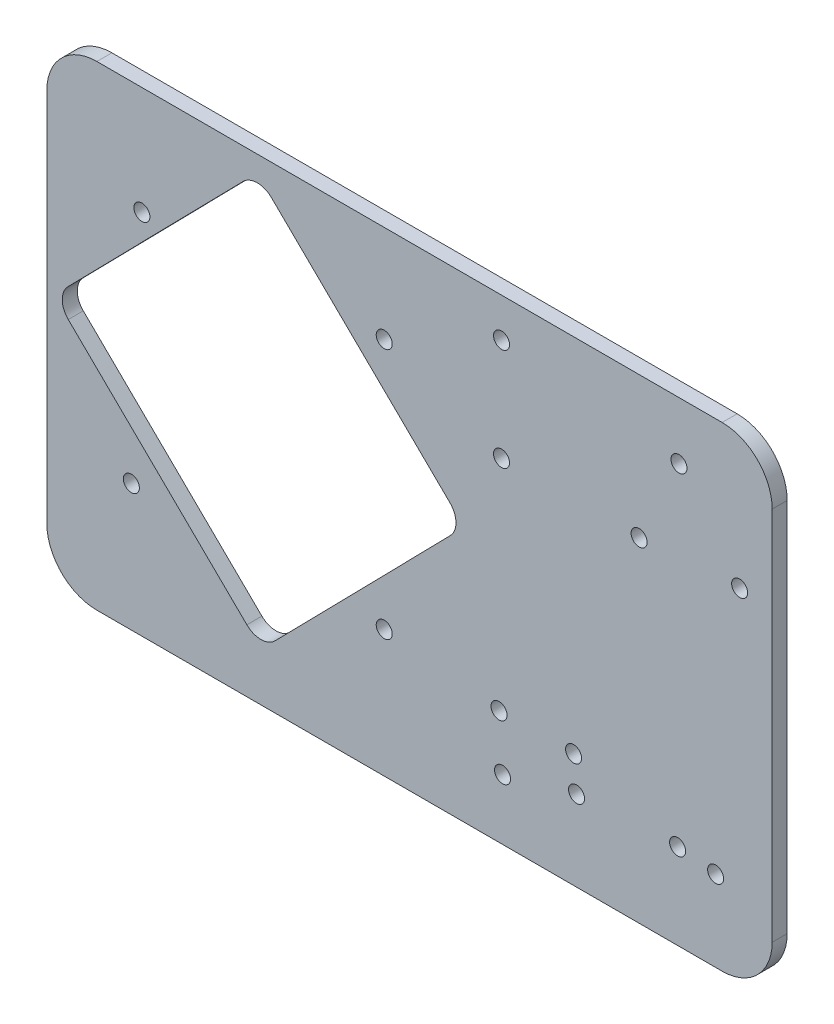
from build123d import *

# Parameters (mm, degrees)
ESQUISSE1_R               = 1.6
T_LE_DE_BASE_PLI_E1_DEPTH = 3


# Sheet-metal steps are written as plain solids
with BuildPart() as part:
    # Esquisse1 → Tôle de base pliée1 (new body)
    with BuildSketch(Plane.XY):
        with BuildLine():
            Line((10, 0), (135, 0))
            ThreePointArc((135, 0), (142.071067812, 2.928932188), (145, 10))
            Line((145, 10), (145, 85))
            ThreePointArc((145, 85), (142.071067812, 92.071067812), (135, 95))
            Line((135, 95), (10, 95))
            ThreePointArc((10, 95), (2.928932188, 92.071067812), (0, 85))
            Line((0, 85), (0, 10))
            ThreePointArc((0, 10), (2.928932188, 2.928932188), (10, 0))
        make_face()
        with Locations((90.9, 87.2)):
            Circle(ESQUISSE1_R, mode=Mode.SUBTRACT)
        with Locations((126.368886423, 83.535840528)):
            Circle(ESQUISSE1_R, mode=Mode.SUBTRACT)
        with Locations((138.5, 68.05)):
            Circle(ESQUISSE1_R, mode=Mode.SUBTRACT)
        with Locations((118.4, 66.74856953)):
            Circle(ESQUISSE1_R, mode=Mode.SUBTRACT)
        with Locations((90.9, 66.74856953)):
            Circle(ESQUISSE1_R, mode=Mode.SUBTRACT)
        with Locations((126.1, 17.1)):
            Circle(ESQUISSE1_R, mode=Mode.SUBTRACT)
        with Locations((133.7, 16.15)):
            Circle(ESQUISSE1_R, mode=Mode.SUBTRACT)
        with Locations((105.3, 22.8)):
            Circle(ESQUISSE1_R, mode=Mode.SUBTRACT)
        with Locations((90.4, 22.8)):
            Circle(ESQUISSE1_R, mode=Mode.SUBTRACT)
        with Locations((91.1, 12.1)):
            Circle(ESQUISSE1_R, mode=Mode.SUBTRACT)
        with Locations((105.9, 16.1)):
            Circle(ESQUISSE1_R, mode=Mode.SUBTRACT)
        with Locations((67.45, 25.4)):
            Circle(ESQUISSE1_R, mode=Mode.SUBTRACT)
        with Locations((19, 73.4)):
            Circle(ESQUISSE1_R, mode=Mode.SUBTRACT)
        with Locations((16.9, 25.4)):
            Circle(ESQUISSE1_R, mode=Mode.SUBTRACT)
        with Locations((67.45, 75.6)):
            Circle(ESQUISSE1_R, mode=Mode.SUBTRACT)
        with BuildLine():
            Line((44.882149159, 88.890256032), (80.590443676, 53.891431727))
            ThreePointArc((80.590443676, 53.891431727), (81.790336387, 51.074901862), (80.647201293, 48.234862221))
            Line((80.647201293, 48.234862221), (45.648376988, 12.526567705))
            ThreePointArc((45.648376988, 12.526567705), (42.831847123, 11.326674993), (39.991807483, 12.469810088))
            Line((39.991807483, 12.469810088), (4.283512966, 47.468634392))
            ThreePointArc((4.283512966, 47.468634392), (3.083620254, 50.285164258), (4.226755349, 53.125203898))
            Line((4.226755349, 53.125203898), (39.225579653, 88.833498415))
            ThreePointArc((39.225579653, 88.833498415), (42.042109519, 90.033391126), (44.882149159, 88.890256032))
        make_face(mode=Mode.SUBTRACT)
    extrude(amount=-T_LE_DE_BASE_PLI_E1_DEPTH)


solid = part.part
